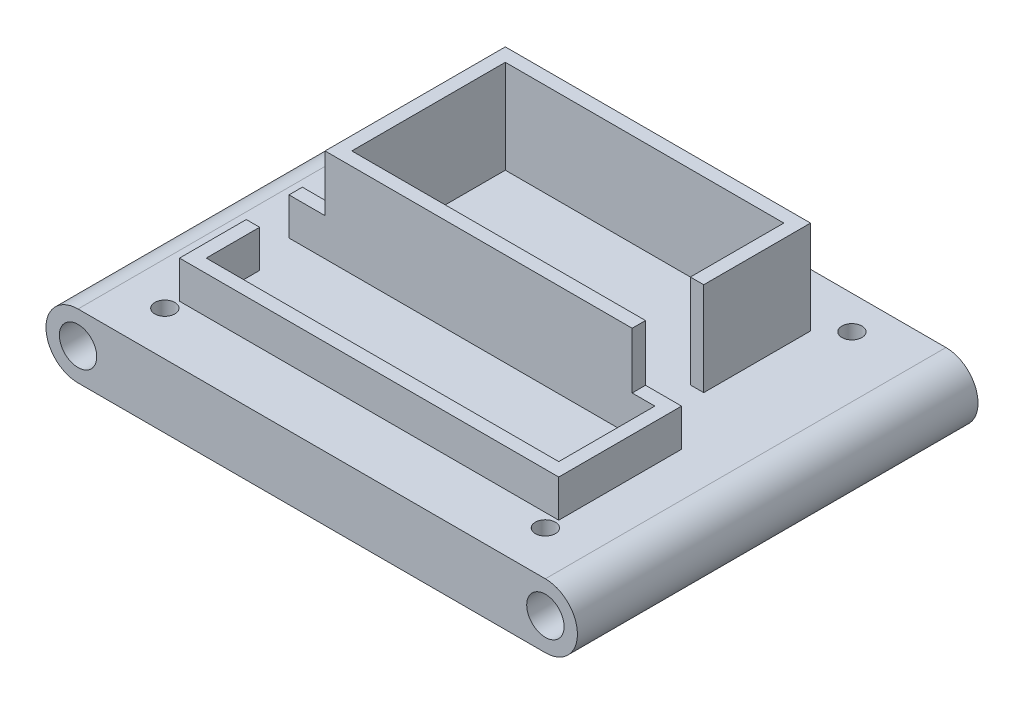
from build123d import *

# Parameters (mm, degrees)
SKETCH1_R           = 3.556
BOSS_EXTRUDE1_DEPTH = 76.2
SKETCH2_R           = 1.905
CUT_EXTRUDE1_DEPTH  = 6.604
BOSS_EXTRUDE2_DEPTH = 17.78
SKETCH4_W           = 6.858
SKETCH4_H           = 2.54
BOSS_EXTRUDE3_DEPTH = 7.112
SKETCH5_R           = 1.905
CUT_EXTRUDE3_DEPTH  = 7.112
SKETCH6_R           = 1.905
CUT_EXTRUDE4_DEPTH  = 7.112


with BuildPart() as part:
    # Sketch1 → Boss-Extrude1 (new body)
    with BuildSketch(Plane.XY):
        with BuildLine():
            Line((-44.45, 6.096), (44.45, 6.096))
            ThreePointArc((44.45, 6.096), (50.546, 0), (44.45, -6.096))
            Line((44.45, -6.096), (-44.45, -6.096))
            ThreePointArc((-44.45, -6.096), (-50.546, 0), (-44.45, 6.096))
        make_face()
        with Locations((-44.45, 0)):
            Circle(SKETCH1_R, mode=Mode.SUBTRACT)
        with Locations((44.45, 0)):
            Circle(SKETCH1_R, mode=Mode.SUBTRACT)
    extrude(amount=BOSS_EXTRUDE1_DEPTH)

    # Sketch2 → Cut-Extrude1 (cut)
    with BuildSketch(Plane.XZ.offset(6.096)):
        with Locations((-9.144, 69.215)):
            Circle(SKETCH2_R)
        with Locations((27.051, 60.833)):
            Circle(SKETCH2_R)
        with Locations((-28.956, 69.215)):
            Circle(SKETCH2_R)
        with Locations((-28.956, 6.985)):
            Circle(SKETCH2_R)
        with Locations((-9.144, 6.985)):
            Circle(SKETCH2_R)
        with Locations((11.049, 60.833)):
            Circle(SKETCH2_R)
        with Locations((11.049, 15.367)):
            Circle(SKETCH2_R)
        with Locations((27.051, 15.367)):
            Circle(SKETCH2_R)
    extrude(amount=-CUT_EXTRUDE1_DEPTH, mode=Mode.SUBTRACT)

    # Sketch3 → Boss-Extrude2 (add)
    with BuildSketch(Plane(origin=(0, 6.096, 0), x_dir=(1, 0, 0), z_dir=(0, 1, 0))):
        Polygon((-29.21, -10.16), (-29.21, -44.45), (29.21, -44.45), (29.21, -41.91), (-26.67, -41.91), (-26.67, -12.7), (26.307716114, -12.7), (26.307716114, -30.48), (28.847716114, -30.48), (28.847716114, -10.16), align=None)
    extrude(amount=BOSS_EXTRUDE2_DEPTH)

    # Sketch4 → Boss-Extrude3 (add)
    with BuildSketch(Plane(origin=(0, 6.096, 0), x_dir=(1, 0, 0), z_dir=(0, 1, 0))):
        Polygon((29.21, -41.91), (29.21, -44.45), (33.528, -44.45), (33.528, -62.738), (-33.528, -62.738), (-33.528, -52.578), (-36.068, -52.578), (-36.068, -65.278), (36.068, -65.278), (36.068, -41.91), align=None)
        with Locations((-32.639, -43.18)):
            Rectangle(SKETCH4_W, SKETCH4_H)
    extrude(amount=BOSS_EXTRUDE3_DEPTH)

    # Sketch5 → Cut-Extrude3 (cut)
    with BuildSketch(Plane(origin=(0, 6.096, 0), x_dir=(1, 0, 0), z_dir=(0, 1, 0))):
        with Locations((36.068, -67.818)):
            Circle(SKETCH5_R)
        with Locations((32.911716114, -6.35)):
            Circle(SKETCH5_R)
    extrude(amount=-CUT_EXTRUDE3_DEPTH, mode=Mode.SUBTRACT)

    # Sketch6 → Cut-Extrude4 (cut)
    with BuildSketch(Plane(origin=(0, 6.096, 0), x_dir=(1, 0, 0), z_dir=(0, 1, 0))):
        with Locations((-36.322, -67.818)):
            Circle(SKETCH6_R)
        with Locations((-33.274, -6.35)):
            Circle(SKETCH6_R)
    extrude(amount=-CUT_EXTRUDE4_DEPTH, mode=Mode.SUBTRACT)


solid = part.part
